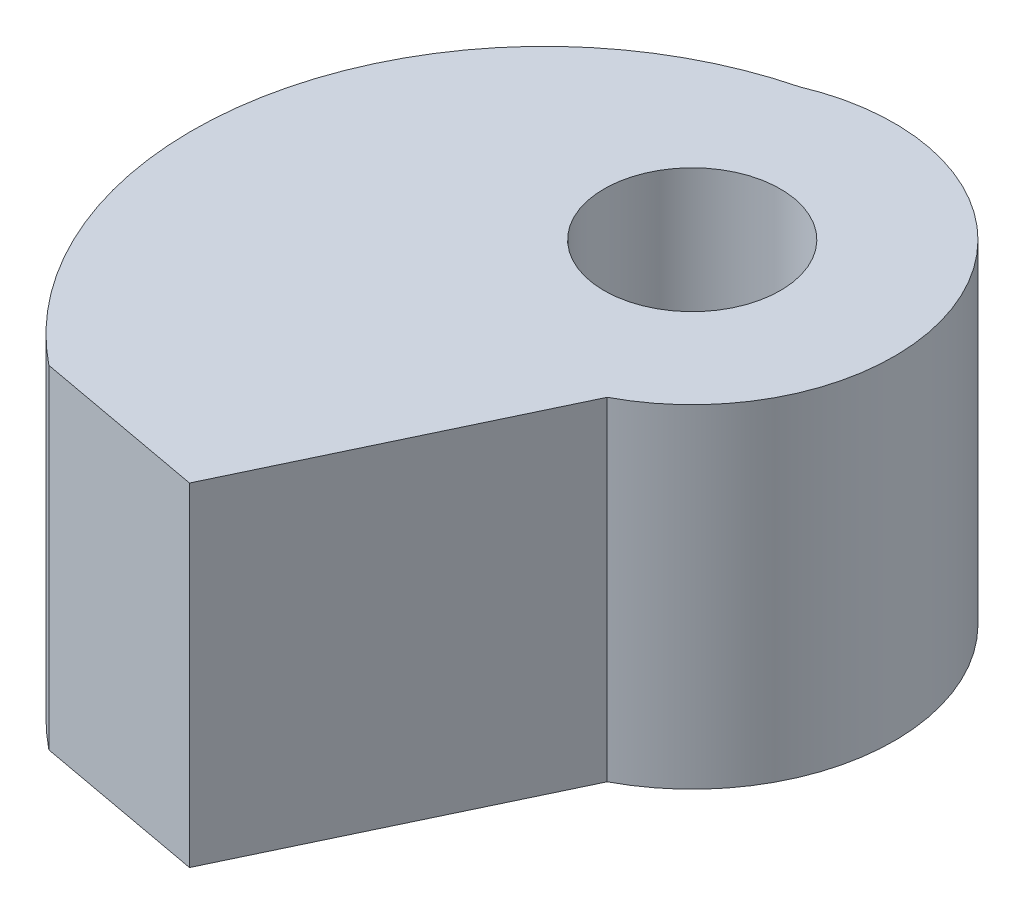
from build123d import *

# Parameters (mm, degrees)
ESQUISSE1_R             = 5.158029836
ESQUISSE1_R_2           = 2.45
BOSS_EXTRU_1_DEPTH      = 2.5
ESQUISSE2_R             = 5.158029836
ESQUISSE2_R_2           = 1
BOSS_EXTRU_2_DEPTH      = 6
ESQUISSE3_R             = 2.25
ENL_V_MAT_EXTRU_1_DEPTH = 5.5
BOSS_EXTRU_3_DEPTH      = 8.5


with BuildPart() as part:
    # Esquisse1 → Boss.-Extru.1 (new body)
    with BuildSketch(Plane(origin=(0, 0, 0), x_dir=(1, 0, 0), z_dir=(0, 1, 0))):
        Circle(ESQUISSE1_R)
        Circle(ESQUISSE1_R_2, mode=Mode.SUBTRACT)
    extrude(amount=BOSS_EXTRU_1_DEPTH)

    # Esquisse2 → Boss.-Extru.2 (add)
    with BuildSketch(Plane(origin=(0, 2.5, 0), x_dir=(1, 0, 0), z_dir=(0, 1, 0))):
        Circle(ESQUISSE2_R)
        Circle(ESQUISSE2_R_2, mode=Mode.SUBTRACT)
    extrude(amount=BOSS_EXTRU_2_DEPTH)

    # Esquisse3 → Enlèv. mat.-Extru.1 (cut)
    with BuildSketch(Plane(origin=(0, 8.5, 0), x_dir=(1, 0, 0), z_dir=(0, 1, 0))):
        Circle(ESQUISSE3_R)
    extrude(amount=-ENL_V_MAT_EXTRU_1_DEPTH, mode=Mode.SUBTRACT)

    # Esquisse4 → Boss.-Extru.3 (add)
    with BuildSketch(Plane(origin=(0, 8.5, 0), x_dir=(1, 0, 0), z_dir=(0, 1, 0))):
        with BuildLine():
            Line((-1.037795618, -11.793856541), (2.397590173, -4.566928196))
            Line((2.397590173, -4.566928196), (-3.163581526, -1.890920922))
            Line((-3.163581526, -1.890920922), (-2.822551903, 2.539113809))
            Line((-2.822551903, 2.539113809), (1.508201091, 4.932605929))
            ThreePointArc((1.508201091, 4.932605929), (-8.045655006, -0.374198721), (-5.435325365, -10.986668796))
            Line((-5.435325365, -10.986668796), (-1.037795618, -11.793856541))
        make_face()
    extrude(amount=-BOSS_EXTRU_3_DEPTH)


solid = part.part
